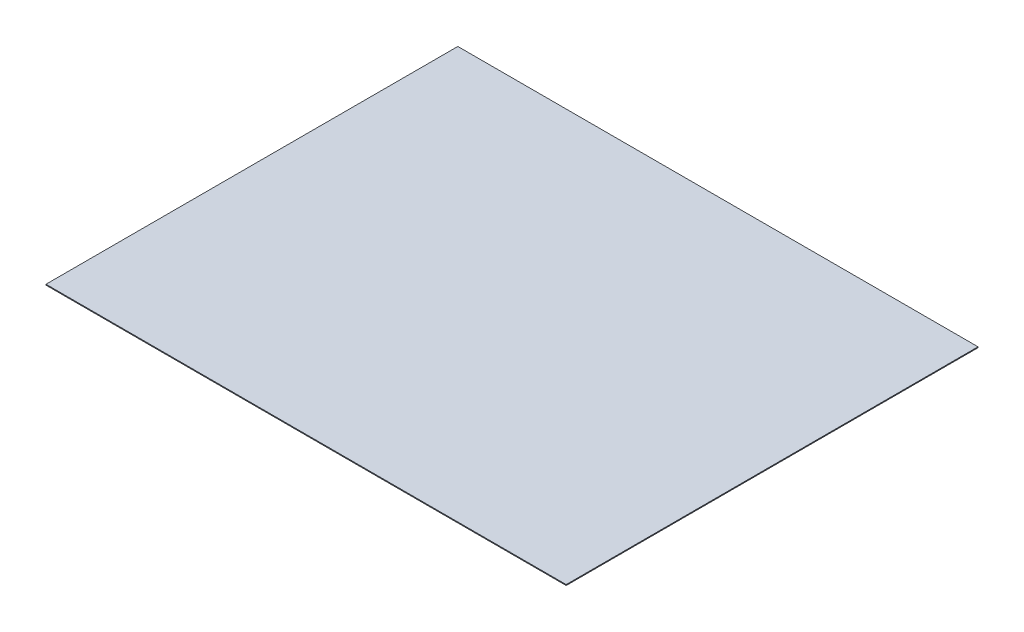
from build123d import *

# Parameters (mm, degrees)
SKETCH1_W          = 1200
SKETCH1_H          = 950
BASE_FLANGE1_DEPTH = 2


# Sheet-metal steps are written as plain solids
with BuildPart() as part:
    # Sketch1 → Base-Flange1 (new body)
    with BuildSketch(Plane(origin=(0, 0, 0), x_dir=(1, 0, 0), z_dir=(0, 1, 0))):
        Rectangle(SKETCH1_W, SKETCH1_H)
    extrude(amount=-BASE_FLANGE1_DEPTH)


solid = part.part
